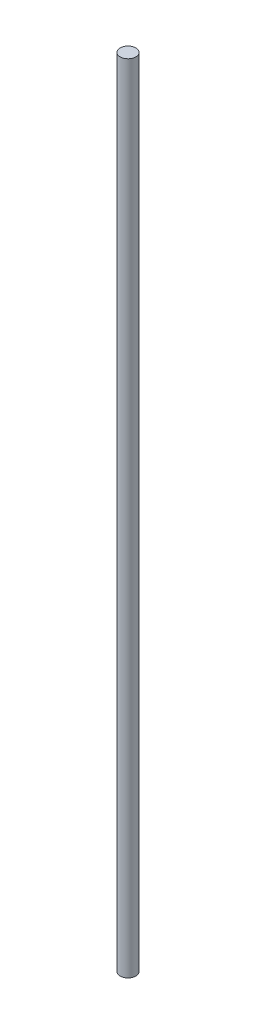
from build123d import *

# Parameters (mm, degrees)
SKETCH1_R           = 5
BOSS_EXTRUDE1_DEPTH = 509


with BuildPart() as part:
    # Sketch1 → Boss-Extrude1 (new body)
    with BuildSketch(Plane(origin=(0, 0, 0), x_dir=(1, 0, 0), z_dir=(0, 1, 0))):
        Circle(SKETCH1_R)
    extrude(amount=BOSS_EXTRUDE1_DEPTH)


solid = part.part
